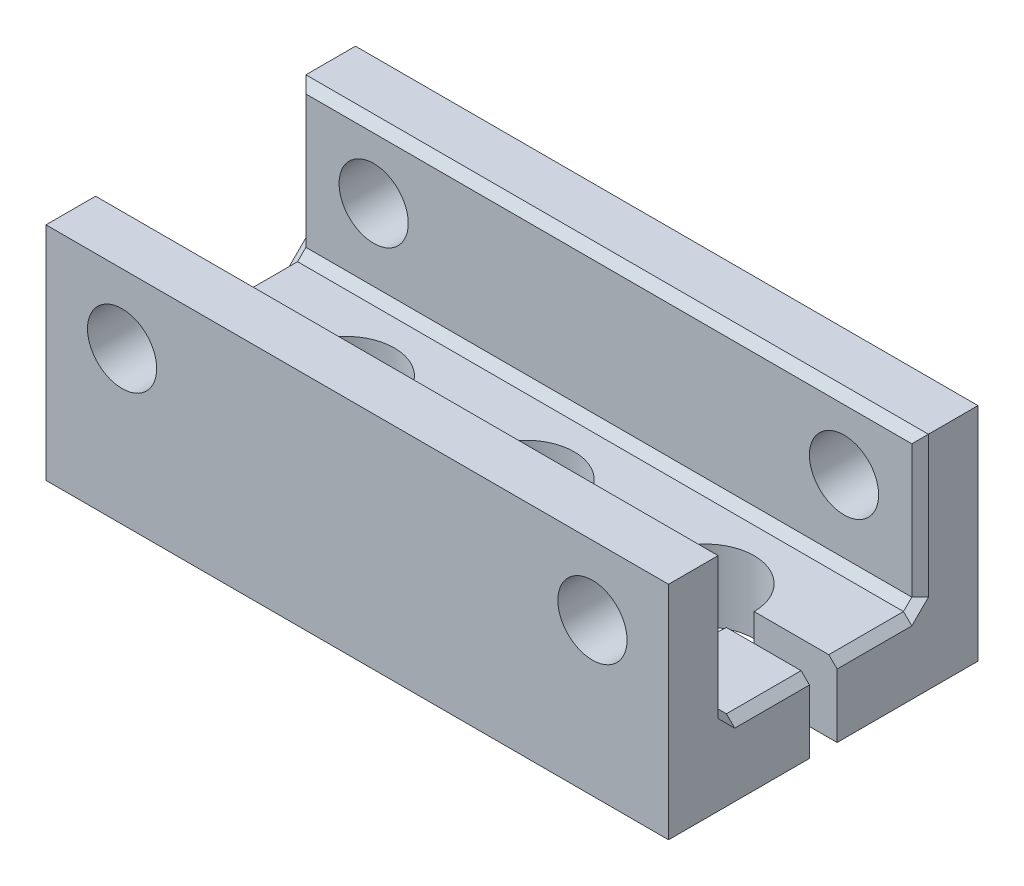
from build123d import *

# Parameters (mm, degrees)
SALIENTE_EXTRUIR1_DEPTH   = 2.6
SALIENTE_EXTRUIR1_2_DEPTH = 2.6
CROQUIS2_W                = 22.5
CROQUIS2_H                = 2.092363452
SALIENTE_EXTRUIR2_DEPTH   = 8
CHAFL_N1_SIZE             = 0.3
CHAFL_N2_SIZE             = 0.3
CORTAR_EXTRUIR2_START     = 7
CORTAR_EXTRUIR2_OUTLINE_R = 1.25
CORTAR_EXTRUIR2_DEPTH     = 2.092363452
CORTAR_EXTRUIR3_START     = -15
CROQUIS5_R                = 1.25
CORTAR_EXTRUIR3_DEPTH     = 15


# Read off the part's stored shape, not the designer's step: Cortar-Extruir2
with BuildPart() as part:
    # Croquis1 → Saliente-Extruir1 (new body)
    with BuildSketch(Plane(origin=(0, 0, 0), x_dir=(1, 0, 0), z_dir=(0, 1, 0))):
        with BuildLine():
            Line((-11.25, 3.5), (-11.25, 0.5))
            Line((-11.25, 0.5), (-8.25, 0.5))
            ThreePointArc((-8.25, 0.5), (-6.5, 2.25), (-4.75, 0.5))
            Line((-4.75, 0.5), (-1.75, 0.5))
            ThreePointArc((-1.75, 0.5), (0, 2.25), (1.75, 0.5))
            Line((1.75, 0.5), (4.75, 0.5))
            ThreePointArc((4.75, 0.5), (6.5, 2.25), (8.25, 0.5))
            Line((8.25, 0.5), (11.25, 0.5))
            Line((11.25, 0.5), (11.25, 3.5))
            Line((11.25, 3.5), (-11.25, 3.5))
        make_face()
    extrude(amount=SALIENTE_EXTRUIR1_DEPTH)



with BuildPart() as body_2:
    # Croquis1 → Saliente-Extruir1 2 (new body)
    with BuildSketch(Plane(origin=(0, 0, 0), x_dir=(1, 0, 0), z_dir=(0, 1, 0))):
        with BuildLine():
            Line((-11.25, -3.5), (-11.25, -0.5))
            Line((-11.25, -0.5), (-8.25, -0.5))
            ThreePointArc((-8.25, -0.5), (-6.5, -2.25), (-4.75, -0.5))
            Line((-4.75, -0.5), (-1.75, -0.5))
            ThreePointArc((-1.75, -0.5), (0, -2.25), (1.75, -0.5))
            Line((1.75, -0.5), (4.75, -0.5))
            ThreePointArc((4.75, -0.5), (6.5, -2.25), (8.25, -0.5))
            Line((8.25, -0.5), (11.25, -0.5))
            Line((11.25, -0.5), (11.25, -3.5))
            Line((11.25, -3.5), (-11.25, -3.5))
        make_face()
    extrude(amount=SALIENTE_EXTRUIR1_2_DEPTH)


with BuildPart() as part_1:
    add(part.part)

    add(body_2.part)  # Saliente-Extruir2 merges body 2
    # Croquis2 → Saliente-Extruir2 (add)
    with BuildSketch(Plane(origin=(0, 0, 0), x_dir=(1, 0, 0), z_dir=(0, 1, 0))):
        with Locations((0, 4.546181726)):
            Rectangle(CROQUIS2_W, CROQUIS2_H)
        with Locations((0, -4.546181726)):
            Rectangle(CROQUIS2_W, CROQUIS2_H)
    extrude(amount=SALIENTE_EXTRUIR2_DEPTH)

    # Chaflán1
    chafl_n1_edges = [part_1.edges().sort_by_distance(p)[0] for p in [
        (11.25, 2.6, -2),
        (0, 2.6, -3.5),
        (-11.25, 5.3, -3.5),
        (11.25, 5.3, -3.5),
        (0, 8, -3.5),
        (-11.25, 2.6, -2),
    ]]
    chamfer(chafl_n1_edges, length=CHAFL_N1_SIZE)

    # Chaflán2
    chafl_n2_edges = [part_1.edges().sort_by_distance(p)[0] for p in [
        (-11.25, 2.6, 2),
        (11.25, 5.3, 3.5),
        (-11.25, 5.3, 3.5),
        (0, 8, 3.5),
        (0, 2.6, 3.5),
        (11.25, 2.6, 2),
    ]]
    chamfer(chafl_n2_edges, length=CHAFL_N2_SIZE)

    # Cortar-Extruir2 outline → Cortar-Extruir2 (cut)
    with BuildSketch(Plane.XY.offset(-3.5).offset(CORTAR_EXTRUIR2_START)):
        with Locations((8.5, 5.5)):
            Circle(CORTAR_EXTRUIR2_OUTLINE_R)
        with Locations((-8.5, 5.5)):
            Circle(CORTAR_EXTRUIR2_OUTLINE_R)
    extrude(amount=CORTAR_EXTRUIR2_DEPTH, mode=Mode.SUBTRACT)

    # Croquis5 → Cortar-Extruir3 (cut)
    with BuildSketch(Plane.XY.offset(5.592363452).offset(CORTAR_EXTRUIR3_START)):
        with Locations((-8.5, 5.5)):
            Circle(CROQUIS5_R)
        with Locations((8.5, 5.5)):
            Circle(CROQUIS5_R)
    extrude(amount=CORTAR_EXTRUIR3_DEPTH, mode=Mode.SUBTRACT)


solid = part_1.part
